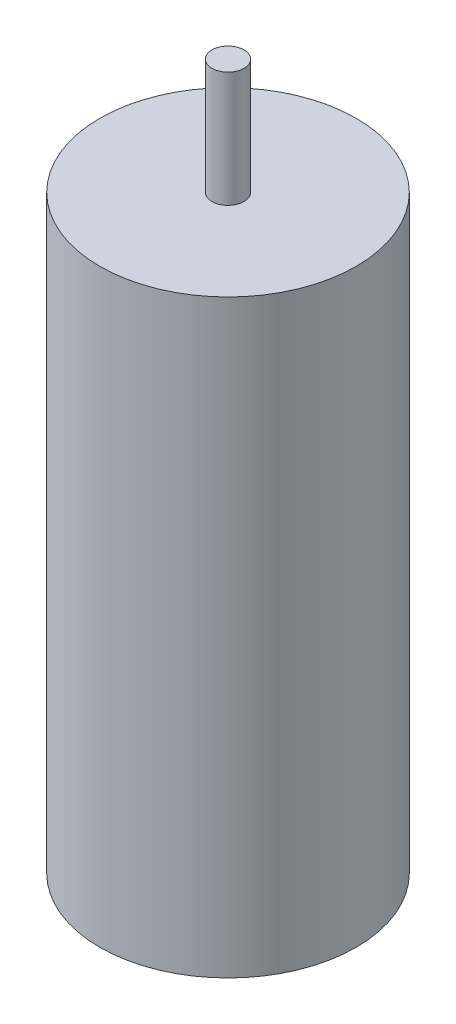
from build123d import *


with BuildPart() as part:
    # Sketch4 → Revolve1 (revolve)
    with BuildSketch(Plane.XY):
        Polygon((0, -40.384716544), (20, -40.384716544), (20, 51.615283456), (2.5, 51.615283456), (2.5, 69.615283456), (0, 69.615283456), align=None)
    revolve(axis=Axis((0, 88.106333556, 0), (0, -1, 0)))


solid = part.part
